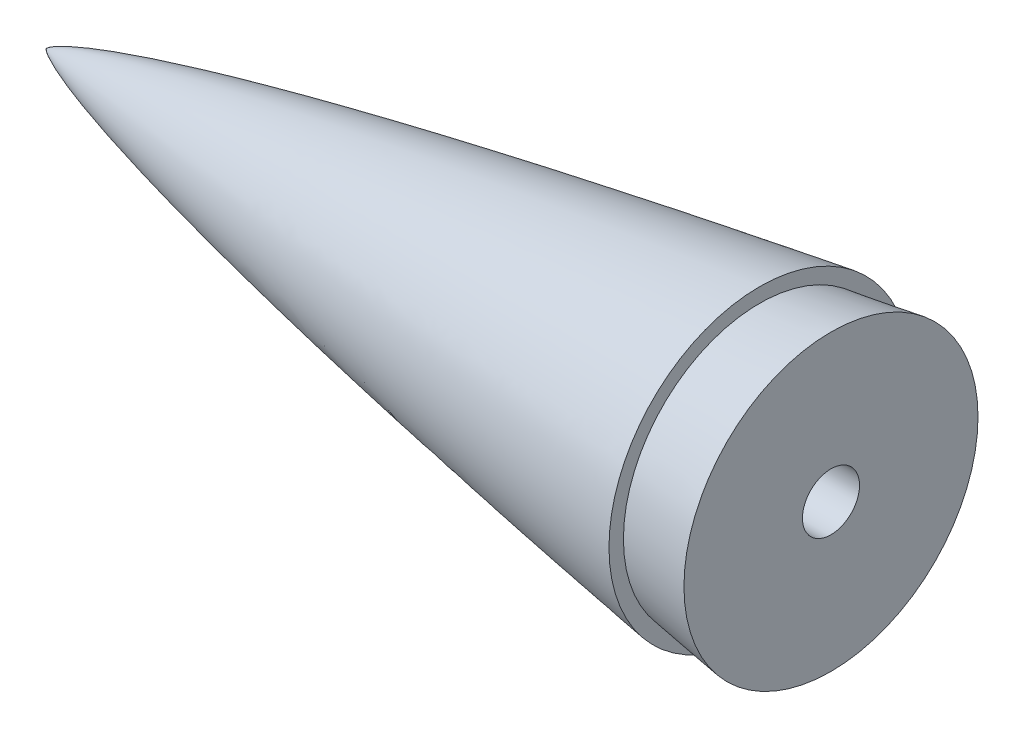
from build123d import *

# Parameters (mm, degrees)
F_8_0_8_DIAMETER_HOLE1_D     = 8
F_8_0_8_DIAMETER_HOLE1_DEPTH = 14.3
F_8_0_8_DIAMETER_HOLE1_TIP   = 9.656854249


with BuildPart() as part:
    # Sketch3 → Revolve2 (revolve)
    with BuildSketch(Plane.XY):
        with BuildLine():
            Line((98, 12.677962629), (98, 0))
            Line((98, 0), (110, 0))
            Line((110, 0), (110, 18.782967048))
            Line((110, 18.782967048), (110, 20.607573734))
            Line((110, 20.607573734), (100, 19.091611952))
            Line((100, 19.091611952), (100, 21.115122079))
            add(Edge.make_bspline(
                [(0, 0), (0.002661369, 0.00735768), (0.009108664, 0.021455176), (0.026858739, 0.047022825), (0.06841925, 0.093346235), (0.131428409, 0.1510252), (0.216810716, 0.21833703), (0.338162364, 0.304110587), (0.48394243, 0.397396692), (0.655054985, 0.498068807), (0.851568565, 0.605626998), (1.137654509, 0.753350528), (1.581543682, 0.966113556), (2.335050733, 1.296122672), (3.682901567, 1.826629283), (6.111473252, 2.674476309), (10.574628301, 4.037968264), (18.951733743, 6.252001296), (33.570100518, 9.565304084), (55.696989193, 13.87955535), (75.630704241, 17.284505313), (91.271257146, 19.773434094), (100, 21.115122079)],
                knots=[0, 0, 0, 0, 0, 4.1103e-05, 8.2207e-05, 0.000164413, 0.000328826, 0.000493239, 0.000657652, 0.000951494, 0.001245335, 0.001544792, 0.001844249, 0.002657057, 0.00385252, 0.005901677, 0.009515863, 0.016280764, 0.028569004, 0.051793804, 0.088907366, 0.135691177, 0.135691177, 0.135691177, 0.135691177, 0.135691177], degree=4))
            Line((0, 0), (4.552555597, 0))
            Line((4.552555597, 0), (92.014704807, 17.579920746))
            ThreePointArc((92.014704807, 17.579920746), (96.168084913, 16.546197108), (98, 12.677962629))
        make_face()
    revolve(axis=Axis((0, 0, 0), (1, 0, 0)))

    # Ø8.0 (8) Diameter Hole1
    with Locations(Plane(origin=(110, 0, 0), x_dir=(0, 0, 1), z_dir=(1, 0, 0))):
        with Locations((0, 0)):
            Hole(F_8_0_8_DIAMETER_HOLE1_D / 2, depth=F_8_0_8_DIAMETER_HOLE1_DEPTH)
            with Locations((0, 0, -(F_8_0_8_DIAMETER_HOLE1_DEPTH + F_8_0_8_DIAMETER_HOLE1_TIP / 2))):  # 45° drill point
                Cone(0, F_8_0_8_DIAMETER_HOLE1_D / 2, F_8_0_8_DIAMETER_HOLE1_TIP, mode=Mode.SUBTRACT)


solid = part.part
